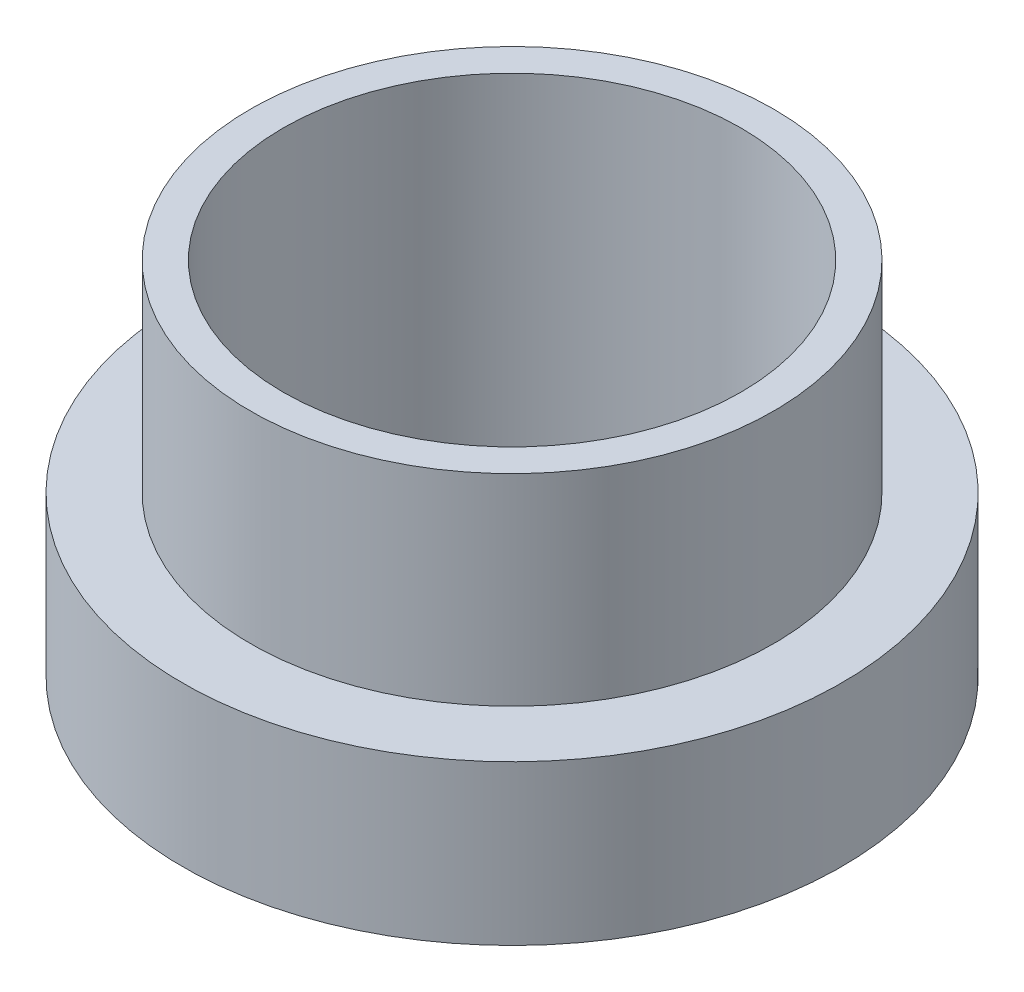
from build123d import *

# Parameters (mm, degrees)
SKETCH1_R           = 8
SKETCH1_R_2         = 5.55625
BOSS_EXTRUDE1_DEPTH = 3.8626
SKETCH2_R           = 6.35
SKETCH2_R_2         = 5.55625
BOSS_EXTRUDE2_DEPTH = 4.89


with BuildPart() as part:
    # Sketch1 → Boss-Extrude1 (new body)
    with BuildSketch(Plane(origin=(0, 0, 0), x_dir=(1, 0, 0), z_dir=(0, 1, 0))):
        Circle(SKETCH1_R)
        Circle(SKETCH1_R_2, mode=Mode.SUBTRACT)
    extrude(amount=BOSS_EXTRUDE1_DEPTH)

    # Sketch2 → Boss-Extrude2 (add)
    with BuildSketch(Plane(origin=(0, 3.8626, 0), x_dir=(1, 0, 0), z_dir=(0, 1, 0))):
        Circle(SKETCH2_R)
        Circle(SKETCH2_R_2, mode=Mode.SUBTRACT)
    extrude(amount=BOSS_EXTRUDE2_DEPTH)


solid = part.part
